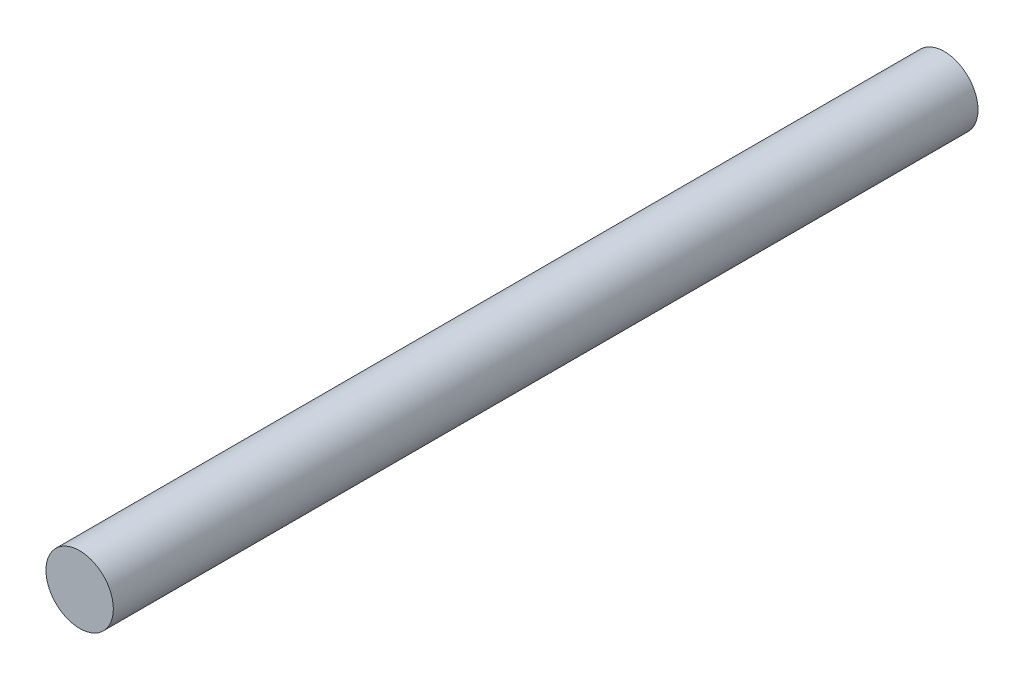
from build123d import *

# Parameters (mm, degrees)
BOSS_EXTRUDE1_DEPTH      = 32.004
BOSS_EXTRUDE1_DEPTH_BACK = 19.304
SKETCH3_R                = 2


with BuildPart() as part:
    # Sketch3 → Boss-Extrude1 (new, two sides: drawn at the far end of the back side and taken through both)
    with BuildSketch(Plane.XY.offset(-BOSS_EXTRUDE1_DEPTH_BACK)):
        Circle(SKETCH3_R)
    extrude(amount=BOSS_EXTRUDE1_DEPTH + BOSS_EXTRUDE1_DEPTH_BACK)


solid = part.part
